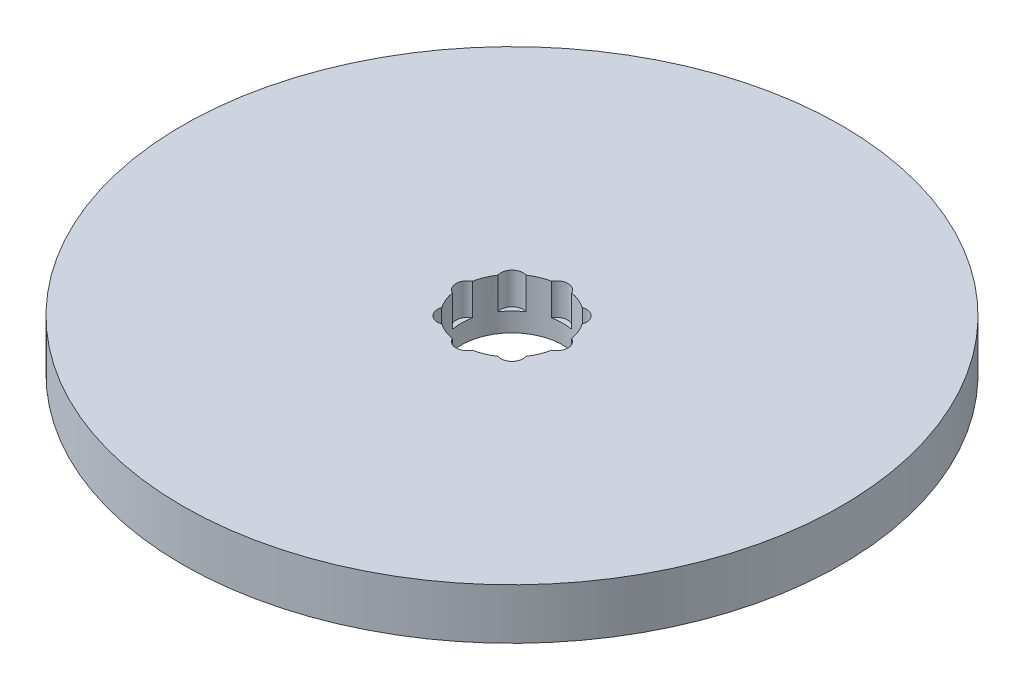
from build123d import *

# Parameters (mm, degrees)
SKETCH1_R           = 65
BOSS_EXTRUDE1_DEPTH = 10
SKETCH2_R           = 10
CUT_EXTRUDE1_DEPTH  = 93.466210045
SKETCH3_R           = 2.208184954
CUT_EXTRUDE2_DEPTH  = 6.259691663
CIRPATTERN1_COUNT   = 8


with BuildPart() as part:
    # Sketch1 → Boss-Extrude1 (new body)
    with BuildSketch(Plane(origin=(0, 0, 0), x_dir=(1, 0, 0), z_dir=(0, 1, 0))):
        Circle(SKETCH1_R)
    extrude(amount=BOSS_EXTRUDE1_DEPTH)

    # Sketch2 → Cut-Extrude1 (cut, through all)
    with BuildSketch(Plane(origin=(0, 0, 0), x_dir=(1, 0, 0), z_dir=(0, 1, 0))):
        Circle(SKETCH2_R)
    extrude(amount=CUT_EXTRUDE1_DEPTH, mode=Mode.SUBTRACT)

    # Sketch3 → Cut-Extrude2 (cut)
    with BuildSketch(Plane(origin=(0, 10, 0), x_dir=(1, 0, 0), z_dir=(0, 1, 0))):
        with Locations((-8.818324689, 0)):
            Circle(SKETCH3_R)
    cut_extrude2 = extrude(amount=-CUT_EXTRUDE2_DEPTH, mode=Mode.SUBTRACT)

    # CirPattern1: Cut-Extrude2 ×8 about axis
    cirpattern1_axis = Axis((0, 0, 0), (0, 1, 0))
    for i in range(1, CIRPATTERN1_COUNT):
        add(cut_extrude2.rotate(cirpattern1_axis, i * 360 / CIRPATTERN1_COUNT), mode=Mode.SUBTRACT)


solid = part.part
